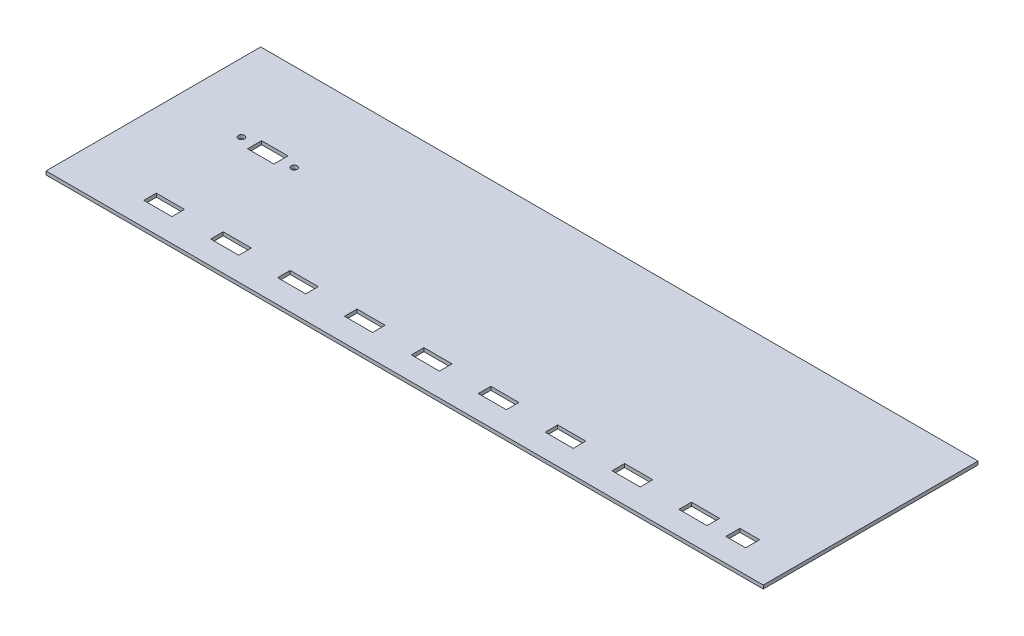
from build123d import *

# Parameters (mm, degrees)
SKETCH1_W           = 408.5
SKETCH1_H           = 122.3
SKETCH1_R           = 1.75
SKETCH1_W_2         = 16
SKETCH1_H_2         = 7.15
SKETCH1_W_3         = 11.25
SKETCH1_H_3         = 8
SKETCH1_W_4         = 15
BOSS_EXTRUDE1_DEPTH = 2


with BuildPart() as part:
    # Sketch1 → Boss-Extrude1 (new body)
    with BuildSketch(Plane(origin=(0, 0, 0), x_dir=(1, 0, 0), z_dir=(0, 1, 0))):
        with Locations((204.25, 61.15)):
            Rectangle(SKETCH1_W, SKETCH1_H)
        with Locations((39, 72.3)):
            Circle(SKETCH1_R, mode=Mode.SUBTRACT)
        with Locations((69, 72.3)):
            Circle(SKETCH1_R, mode=Mode.SUBTRACT)
        with Locations((317.09, 16.875)):
            Rectangle(SKETCH1_W_2, SKETCH1_H_2, mode=Mode.SUBTRACT)
        with Locations((379.5, 17.3)):
            Rectangle(SKETCH1_W_3, SKETCH1_H_3, mode=Mode.SUBTRACT)
        with Locations((355.19, 16.875)):
            Rectangle(SKETCH1_W_2, SKETCH1_H_2, mode=Mode.SUBTRACT)
        with Locations((278.99, 16.875)):
            Rectangle(SKETCH1_W_2, SKETCH1_H_2, mode=Mode.SUBTRACT)
        with Locations((240.89, 16.875)):
            Rectangle(SKETCH1_W_2, SKETCH1_H_2, mode=Mode.SUBTRACT)
        with Locations((202.79, 16.875)):
            Rectangle(SKETCH1_W_2, SKETCH1_H_2, mode=Mode.SUBTRACT)
        with Locations((164.69, 16.875)):
            Rectangle(SKETCH1_W_2, SKETCH1_H_2, mode=Mode.SUBTRACT)
        with Locations((126.59, 16.875)):
            Rectangle(SKETCH1_W_2, SKETCH1_H_2, mode=Mode.SUBTRACT)
        with Locations((88.49, 16.875)):
            Rectangle(SKETCH1_W_2, SKETCH1_H_2, mode=Mode.SUBTRACT)
        with Locations((50.39, 16.875)):
            Rectangle(SKETCH1_W_2, SKETCH1_H_2, mode=Mode.SUBTRACT)
        with Locations((54, 72.3)):
            Rectangle(SKETCH1_W_4, SKETCH1_H_3, mode=Mode.SUBTRACT)
    extrude(amount=BOSS_EXTRUDE1_DEPTH)


solid = part.part
